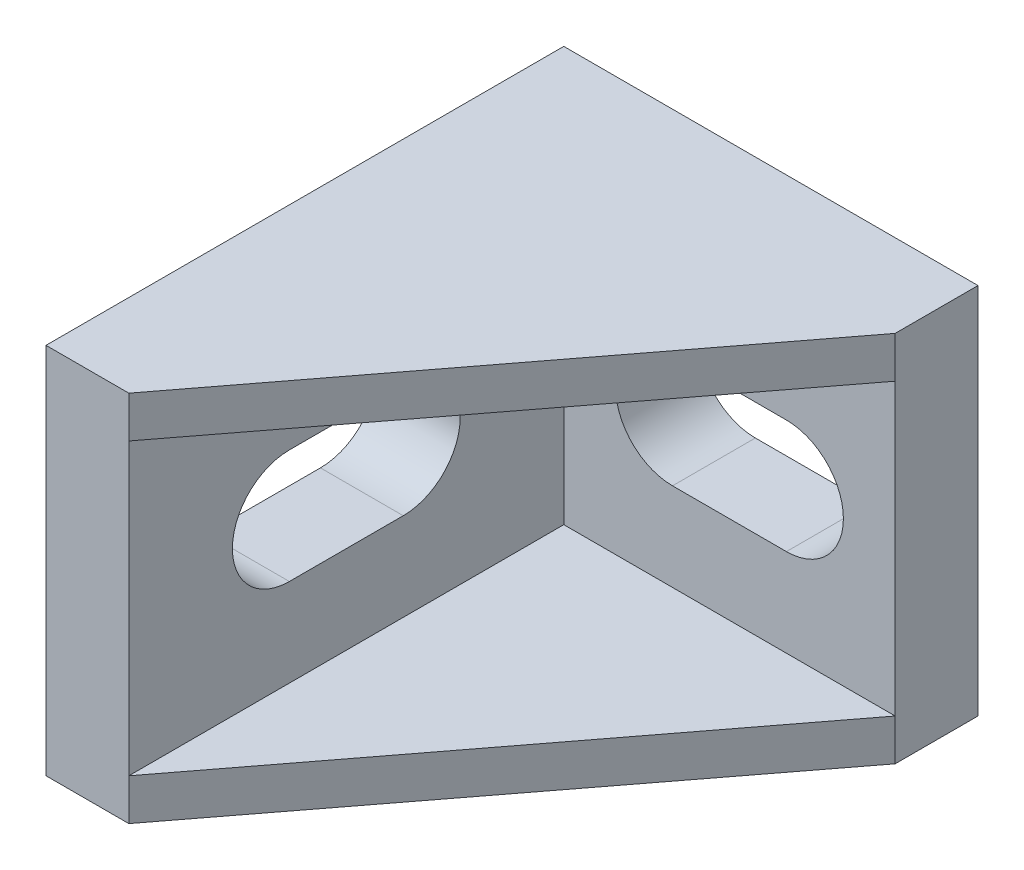
from build123d import *

# Parameters (mm, degrees)
SKETCH_1_W               = 20
SKETCH_1_H               = 18
EXTRUDE_1_DEPTH          = 25
SKETCH_2_W               = 16
SKETCH_2_H               = 14
CUT_EXTRUDE_1_DEPTH      = 21
CUT_EXTRUDE_2_DEPTH      = 32.320919527
CUT_EXTRUDE_2_DEPTH_BACK = 32.320919527
CUT_EXTRUDE_3_DEPTH      = 25.939927827
CUT_EXTRUDE_3_DEPTH_BACK = 25.939927827
CUT_EXTRUDE_4_DEPTH      = 32.016124839
CUT_EXTRUDE_4_DEPTH_BACK = 32.016124839


with BuildPart() as part:
    # 스케치1 → 보스-돌출1 (new body)
    with BuildSketch(Plane.XY):
        Rectangle(SKETCH_1_W, SKETCH_1_H)
    extrude(amount=EXTRUDE_1_DEPTH)

    # 스케치2 → 컷-돌출1 (cut)
    with BuildSketch(Plane.XY.offset(25)):
        with Locations((2, 0)):
            Rectangle(SKETCH_2_W, SKETCH_2_H)
    extrude(amount=-CUT_EXTRUDE_1_DEPTH, mode=Mode.SUBTRACT)

    # 스케치4 → 컷-돌출2 (cut, two sides: drawn at the far end of the back side and taken through both)
    with BuildSketch(Plane(origin=(0, -7, 0), x_dir=(1, 0, 0), z_dir=(0, 1, 0)).offset(-CUT_EXTRUDE_2_DEPTH_BACK)):
        Polygon((-6, -25), (10, -4), (10, -25), align=None)
    extrude(amount=CUT_EXTRUDE_2_DEPTH + CUT_EXTRUDE_2_DEPTH_BACK, mode=Mode.SUBTRACT)

    # 스케치5 → 컷-돌출3 (cut, two sides: drawn at the far end of the back side and taken through both)
    with BuildSketch(Plane.XY.offset(4).offset(-CUT_EXTRUDE_3_DEPTH_BACK)):
        with BuildLine():
            Line((-0.75, 2.75), (4.75, 2.75))
            ThreePointArc((4.75, 2.75), (7.5, 0), (4.75, -2.75))
            Line((4.75, -2.75), (-0.75, -2.75))
            ThreePointArc((-0.75, -2.75), (-3.5, 0), (-0.75, 2.75))
        make_face()
    extrude(amount=CUT_EXTRUDE_3_DEPTH + CUT_EXTRUDE_3_DEPTH_BACK, mode=Mode.SUBTRACT)

    # 스케치6 → 컷-돌출4 (cut, two sides: drawn at the far end of the back side and taken through both)
    with BuildSketch(Plane(origin=(-6, 0, 0), x_dir=(0, 0, -1), z_dir=(1, 0, 0)).offset(-CUT_EXTRUDE_4_DEPTH_BACK)):
        with BuildLine():
            Line((-17.25, 2.75), (-11.75, 2.75))
            ThreePointArc((-11.75, 2.75), (-9, 0), (-11.75, -2.75))
            Line((-11.75, -2.75), (-17.25, -2.75))
            ThreePointArc((-17.25, -2.75), (-20, 0), (-17.25, 2.75))
        make_face()
    extrude(amount=CUT_EXTRUDE_4_DEPTH + CUT_EXTRUDE_4_DEPTH_BACK, mode=Mode.SUBTRACT)


solid = part.part
